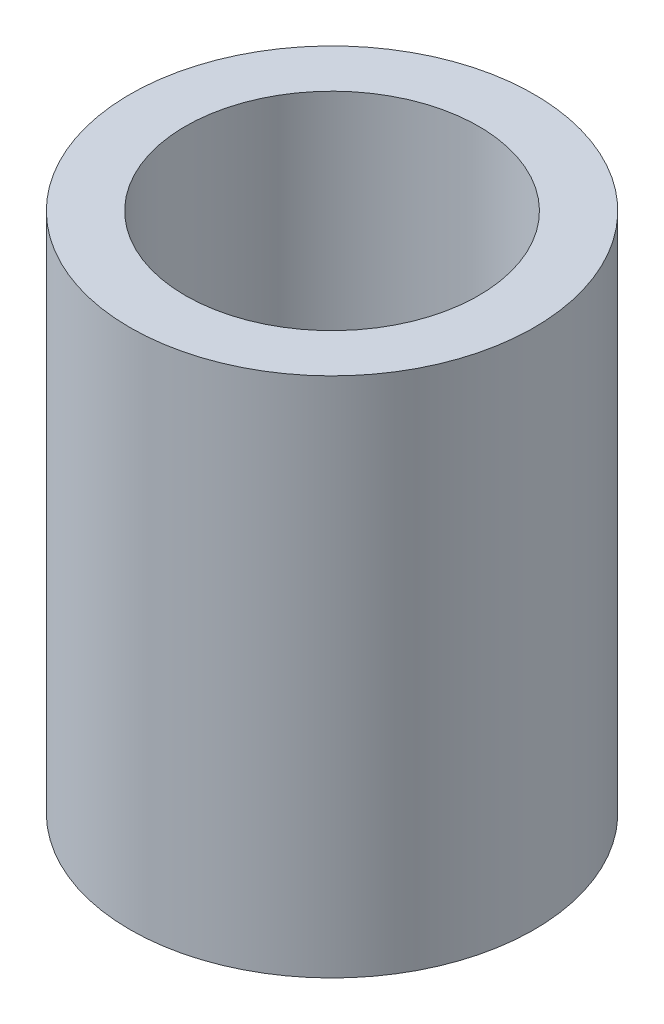
from build123d import *

# Parameters (mm, degrees)
SKETCH1_R           = 3.1
BOSS_EXTRUDE1_DEPTH = 8
SKETCH2_R           = 2.25
CUT_EXTRUDE1_DEPTH  = 10.122499657


with BuildPart() as part:
    # Sketch1 → Boss-Extrude1 (new body)
    with BuildSketch(Plane(origin=(0, 0, 0), x_dir=(1, 0, 0), z_dir=(0, 1, 0))):
        Circle(SKETCH1_R)
    extrude(amount=BOSS_EXTRUDE1_DEPTH)

    # Sketch2 → Cut-Extrude1 (cut, through all)
    with BuildSketch(Plane(origin=(0, 8, 0), x_dir=(1, 0, 0), z_dir=(0, 1, 0))):
        Circle(SKETCH2_R)
    extrude(amount=-CUT_EXTRUDE1_DEPTH, mode=Mode.SUBTRACT)


solid = part.part
